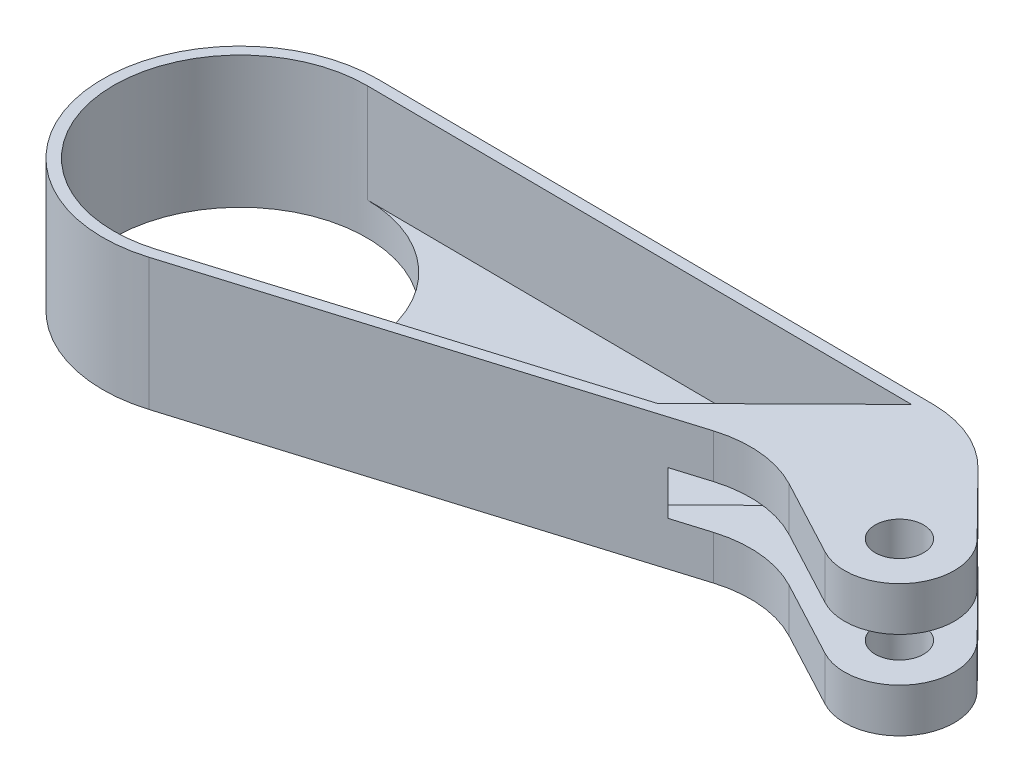
from build123d import *

# Parameters (mm, degrees)
BOSS_EXTRUDE2_DEPTH      = 30
BOSS_EXTRUDE2_DEPTH_BACK = 30
SKETCH1_R                = 57.5
SKETCH1_R_2              = 11
FILLET1_R                = 50
SKETCH4_W                = 140.499701118
SKETCH4_H                = 20
CUT_EXTRUDE1_DEPTH       = 100
CUT_EXTRUDE2_START       = -45
CUT_EXTRUDE2_DEPTH       = 45


with BuildPart() as part:
    # Sketch1 → Boss-Extrude2 (new, two sides: drawn at the far end of the back side and taken through both)
    with BuildSketch(Plane(origin=(0, 0, 0), x_dir=(1, 0, 0), z_dir=(0, 1, 0)).offset(-BOSS_EXTRUDE2_DEPTH_BACK)):
        with BuildLine():
            Line((275.432111298, 60.532518514), (0.446804363, 62.498402906))
            ThreePointArc((0.446804363, 62.498402906), (-61.849437084, -8.994283319), (18.229166667, -59.782501475))
            Line((18.229166667, -59.782501475), (234.977242992, 6.309360031))
            Line((234.977242992, 6.309360031), (288.24694207, -22.065031822))
            ThreePointArc((288.24694207, -22.065031822), (320.037630041, -14.949695059), (317.803593161, 17.550842446))
            Line((317.803593161, 17.550842446), (275.432111298, 60.532518514))
        make_face()
        Circle(SKETCH1_R, mode=Mode.SUBTRACT)
        with Locations((300, 0)):
            Circle(SKETCH1_R_2, mode=Mode.SUBTRACT)
    extrude(amount=BOSS_EXTRUDE2_DEPTH + BOSS_EXTRUDE2_DEPTH_BACK)

    # Fillet1
    fillet1_edges = [part.edges().sort_by_distance(p)[0] for p in [
        (234.977242992, 0, -6.309360031),
        (275.432111298, 0, -60.532518514),
    ]]
    fillet(fillet1_edges, radius=FILLET1_R)

    # Sketch4 → Cut-Extrude1 (cut)
    with BuildSketch(Plane(origin=(169.948199298, 0, -167.535510544), x_dir=(-0.7020336978211087, 0, -0.7121437264510728), z_dir=(0.7121437264510728, 0, -0.7020336978211087))):
        with Locations((-205.929503935, 0)):
            Rectangle(SKETCH4_W, SKETCH4_H)
    extrude(amount=-CUT_EXTRUDE1_DEPTH, mode=Mode.SUBTRACT)

    # Sketch5 → Cut-Extrude2 (cut)
    with BuildSketch(Plane(origin=(0, 30, 0), x_dir=(1, 0, 0), z_dir=(0, 1, 0)).offset(CUT_EXTRUDE2_START)):
        with BuildLine():
            ThreePointArc((57.5, 0), (46.209159896, -34.219344553), (16.770833333, -54.999901357))
            Line((16.770833333, -54.999901357), (191.530630576, -1.711307003))
            Line((191.530630576, -1.711307003), (249.784693425, 55.71574548))
            Line((249.784693425, 55.71574548), (0.411060014, 57.498530674))
            ThreePointArc((0.411060014, 57.498530674), (40.803712765, 40.513047585), (57.5, 0))
        make_face()
    extrude(amount=CUT_EXTRUDE2_DEPTH, mode=Mode.SUBTRACT)


solid = part.part
